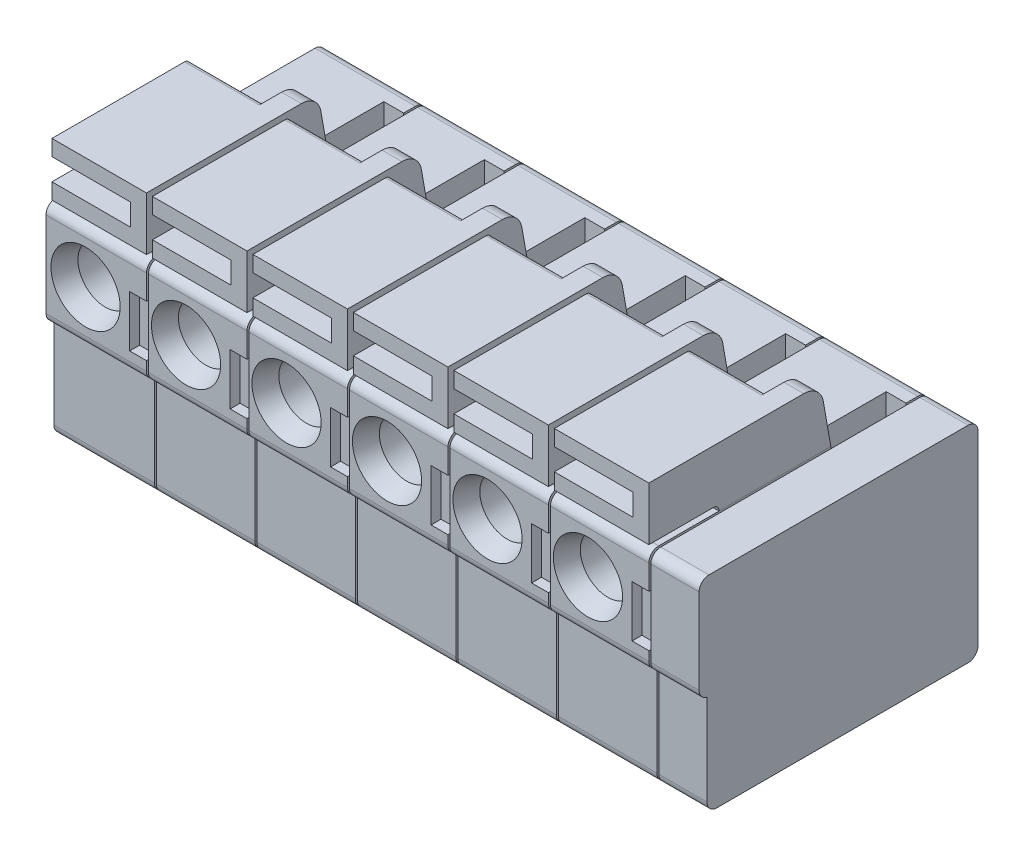
from build123d import *

# Parameters (mm, degrees)
EXTRUDE_1_DEPTH               = 33.02
FILLET_1_R                    = 0.5
SKETCH_2_W                    = 1
SKETCH_2_H                    = 2.5
EXTRUDE_2_DEPTH               = 33.02
EXTRUDE_3_DEPTH               = 33.02
SKETCH_4_W                    = 2.29
SKETCH_4_H                    = 3.5
SKETCH_4_W_2                  = 4.58
SKETCH_4_W_3                  = 4.83
SKETCH_4_W_4                  = 0.3
SKETCH_4_H_2                  = 3
SKETCH_4_W_5                  = 2.54
CUT_EXTRUDE_1_DEPTH           = 39.323496709
SKETCH_5_W                    = 0.85
SKETCH_5_H                    = 2.6
CUT_EXTRUDE_2_DEPTH           = 0.5
SKETCH_6_W                    = 3.98
SKETCH_6_H                    = 1.1
CUT_EXTRUDE_3_DEPTH           = 1.5
SKETCH_7_R                    = 1.75
CUT_EXTRUDE_4_DEPTH           = 1
CUT_EXTRUDE_4_DRAFT           = -20
CUT_EXTRUDE_4_PROFILE_2_DEPTH = 1
CUT_EXTRUDE_4_PROFILE_2_DRAFT = -20
CUT_EXTRUDE_4_PROFILE_3_DEPTH = 1
CUT_EXTRUDE_4_PROFILE_3_DRAFT = -20
CUT_EXTRUDE_4_PROFILE_4_DEPTH = 1
CUT_EXTRUDE_4_PROFILE_4_DRAFT = -20
CUT_EXTRUDE_4_PROFILE_5_DEPTH = 1
CUT_EXTRUDE_4_PROFILE_5_DRAFT = -20
CUT_EXTRUDE_4_PROFILE_6_DEPTH = 1
CUT_EXTRUDE_4_PROFILE_6_DRAFT = -20
SKETCH_8_R                    = 1.386029766
CUT_EXTRUDE_5_DEPTH           = 8
CUT_EXTRUDE_6_DEPTH           = 39.065317548
CUT_EXTRUDE_6_DEPTH_BACK      = 3.78
CUT_EXTRUDE_7_DEPTH           = 3.78
CUT_EXTRUDE_8_DEPTH           = 3.78
CUT_EXTRUDE_9_DEPTH           = 3.78
CUT_EXTRUDE_10_DEPTH          = 3.78
CUT_EXTRUDE_11_DEPTH          = 3.78
SKETCH_17_W                   = 1
SKETCH_17_H                   = 3.8
CUT_EXTRUDE_12_DEPTH          = 3.78
SKETCH_18_W                   = 0.1
SKETCH_18_H                   = 13.4
CUT_EXTRUDE_13_DEPTH          = 39.323496709


with BuildPart() as part:
    # Эскиз1 → Бобышка-Вытянуть1 (new body)
    with BuildSketch(Plane(origin=(0, 0, 0), x_dir=(0, 0, -1), z_dir=(1, 0, 0))):
        Polygon((0.4, 5.1), (0.4, 0), (14.1, 0), (14.1, 10.4), (0, 10.4), (0, 5.1), align=None)
    extrude(amount=EXTRUDE_1_DEPTH)

    # Скругление1
    # the kernel refuses this fillet: 0.5 mm, written as the material it takes off along each edge
    with BuildSketch(Plane(origin=(-1.25, 10.4, -14.1), x_dir=(0, -1, 0), z_dir=(1, 0, 0)), Plane(origin=(-1.25, 0, -14.1), x_dir=(0, 0, 1), z_dir=(1, 0, 0)), Plane(origin=(-1.25, 0, -0.4), x_dir=(0, 1, 0), z_dir=(1, 0, 0)), Plane(origin=(-1.25, 10.4, 0), x_dir=(0, 0, -1), z_dir=(1, 0, 0))) as fillet_1_piece_1:
        with BuildLine():
            CenterArc((FILLET_1_R, -FILLET_1_R), FILLET_1_R, 90, 90)
            Line((0, -FILLET_1_R), (-FILLET_1_R * 0.02, -FILLET_1_R))
            Line((-FILLET_1_R * 0.02, -FILLET_1_R), (-FILLET_1_R * 0.02, FILLET_1_R * 0.02))
            Line((-FILLET_1_R * 0.02, FILLET_1_R * 0.02), (FILLET_1_R, FILLET_1_R * 0.02))
            Line((FILLET_1_R, FILLET_1_R * 0.02), (FILLET_1_R, 0))
        make_face()
    extrude(amount=35.52, mode=Mode.SUBTRACT)
    with BuildSketch(Plane(origin=(-1.224744871, 5.1, 0), x_dir=(0, 1, 0), z_dir=(1, 0, 0))) as fillet_1_piece_2:
        with BuildLine():
            CenterArc((0.489897949, -0.5), FILLET_1_R, 90, 78.463040967)
            Line((0, -0.4), (-0.009797959, -0.398))
            ThreePointArc((-0.009797959, -0.398), (-0.01, -0.2), (-0.01, 0))
            Line((-0.01, 0), (0, 0.01))
            Line((0, 0.01), (0.489897949, 0.01))
            Line((0.489897949, 0.01), (0.489897949, 0))
        make_face()
    extrude(amount=35.469489743, mode=Mode.SUBTRACT)

    # Эскиз5 → Вырез-Вытянуть2 (cut)
    with BuildSketch(Plane.XY):
        with Locations((4.655, 7.36)):
            Rectangle(SKETCH_5_W, SKETCH_5_H)
        with Locations((9.735, 7.36)):
            Rectangle(SKETCH_5_W, SKETCH_5_H)
        with Locations((14.815, 7.36)):
            Rectangle(SKETCH_5_W, SKETCH_5_H)
        with Locations((19.895, 7.36)):
            Rectangle(SKETCH_5_W, SKETCH_5_H)
        with Locations((24.975, 7.36)):
            Rectangle(SKETCH_5_W, SKETCH_5_H)
        with Locations((30.055, 7.36)):
            Rectangle(SKETCH_5_W, SKETCH_5_H)
    extrude(amount=-CUT_EXTRUDE_2_DEPTH, mode=Mode.SUBTRACT)


with BuildPart() as body_2:
    # Эскиз2 → Бобышка-Вытянуть2 (new body)
    with BuildSketch(Plane(origin=(0, 0, 0), x_dir=(0, 0, -1), z_dir=(1, 0, 0))):
        with Locations((12.35, -1.25)):
            Rectangle(SKETCH_2_W, SKETCH_2_H)
        Polygon((12.85, -2.5), (11.85, -2.5), (12.117949192, -3.5), (12.582050808, -3.5), align=None)
        with Locations((4.73, -1.25)):
            Rectangle(SKETCH_2_W, SKETCH_2_H)
        Polygon((5.23, -2.5), (4.23, -2.5), (4.497949192, -3.5), (4.962050808, -3.5), align=None)
    extrude(amount=EXTRUDE_2_DEPTH)


with BuildPart() as body_3:
    # Эскиз3 → Бобышка-Вытянуть3 (new body)
    with BuildSketch(Plane(origin=(0, 0, 0), x_dir=(0, 0, -1), z_dir=(1, 0, 0))):
        with BuildLine():
            Line((3.55, 10.4), (3.55, 10.41))
            ThreePointArc((3.55, 10.41), (3.465060967, 10.615060967), (3.26, 10.7))
            Line((3.26, 10.7), (0, 10.7))
            Line((0, 10.7), (0, 13.4))
            Line((0, 13.4), (7.831919427, 13.4))
            ThreePointArc((7.831919427, 13.4), (8.474707036, 13.166044443), (8.81672718, 12.573648178))
            Line((8.81672718, 12.573648178), (9.2, 10.4))
            Line((9.2, 10.4), (3.55, 10.4))
        make_face()
    extrude(amount=EXTRUDE_3_DEPTH)


with BuildPart() as cut_extrude_1_tool:
    # Эскиз4 → Вырез-Вытянуть1 (new, through all)
    with BuildSketch(Plane.XY):
        with Locations((1.145, -1.75)):
            Rectangle(SKETCH_4_W, SKETCH_4_H)
        with Locations((5.08, -1.75)):
            Rectangle(SKETCH_4_W_2, SKETCH_4_H)
        with Locations((10.16, -1.75)):
            Rectangle(SKETCH_4_W_2, SKETCH_4_H)
        with Locations((15.24, -1.75)):
            Rectangle(SKETCH_4_W_2, SKETCH_4_H)
        with Locations((20.32, -1.75)):
            Rectangle(SKETCH_4_W_2, SKETCH_4_H)
        with Locations((25.4, -1.75)):
            Rectangle(SKETCH_4_W_2, SKETCH_4_H)
        with Locations((30.605, -1.75)):
            Rectangle(SKETCH_4_W_3, SKETCH_4_H)
        with Locations((0.15, 11.9)):
            Rectangle(SKETCH_4_W_4, SKETCH_4_H_2)
        with Locations((5.23, 11.9)):
            Rectangle(SKETCH_4_W_4, SKETCH_4_H_2)
        with Locations((10.31, 11.9)):
            Rectangle(SKETCH_4_W_4, SKETCH_4_H_2)
        with Locations((15.39, 11.9)):
            Rectangle(SKETCH_4_W_4, SKETCH_4_H_2)
        with Locations((20.47, 11.9)):
            Rectangle(SKETCH_4_W_4, SKETCH_4_H_2)
        with Locations((25.55, 11.9)):
            Rectangle(SKETCH_4_W_4, SKETCH_4_H_2)
        with Locations((31.75, 11.9)):
            Rectangle(SKETCH_4_W_5, SKETCH_4_H_2)
    extrude(amount=-CUT_EXTRUDE_1_DEPTH)


with BuildPart() as body_2_1:
    add(body_2.part)

    # Вырез-Вытянуть1: cut by cut_extrude_1_tool
    add(cut_extrude_1_tool.part, mode=Mode.SUBTRACT)


with BuildPart() as body_3_1:
    add(body_3.part)

    # Вырез-Вытянуть1: cut by cut_extrude_1_tool
    add(cut_extrude_1_tool.part, mode=Mode.SUBTRACT)

    # Эскиз6 → Вырез-Вытянуть3 (cut)
    with BuildSketch(Plane.XY):
        with Locations((2.29, 12.05)):
            Rectangle(SKETCH_6_W, SKETCH_6_H)
        with Locations((7.37, 12.05)):
            Rectangle(SKETCH_6_W, SKETCH_6_H)
        with Locations((12.45, 12.05)):
            Rectangle(SKETCH_6_W, SKETCH_6_H)
        with Locations((17.53, 12.05)):
            Rectangle(SKETCH_6_W, SKETCH_6_H)
        with Locations((22.61, 12.05)):
            Rectangle(SKETCH_6_W, SKETCH_6_H)
        with Locations((27.69, 12.05)):
            Rectangle(SKETCH_6_W, SKETCH_6_H)
    extrude(amount=-CUT_EXTRUDE_3_DEPTH, mode=Mode.SUBTRACT)

    # Эскиз9 → Вырез-Вытянуть6 (cut, two sides: drawn at the far end of the back side and taken through both)
    with BuildSketch(Plane.ZY.offset(-0.3).offset(-CUT_EXTRUDE_6_DEPTH_BACK)):
        with BuildLine():
            Line((-3.26, 10.7), (-2.043352076, 10.7))
            Line((-2.043352076, 10.7), (-6.811498201, 12.923423053))
            ThreePointArc((-6.811498201, 12.923423053), (-6.949917637, 13.204109903), (-6.705843636, 13.4))
            Line((-6.705843636, 13.4), (-7.831919427, 13.4))
            ThreePointArc((-7.831919427, 13.4), (-8.474707036, 13.166044443), (-8.81672718, 12.573648178))
            Line((-8.81672718, 12.573648178), (-9.2, 10.4))
            Line((-9.2, 10.4), (-3.55, 10.4))
            Line((-3.55, 10.4), (-3.55, 10.41))
            ThreePointArc((-3.55, 10.41), (-3.465060967, 10.615060967), (-3.26, 10.7))
        make_face()
    extrude(amount=CUT_EXTRUDE_6_DEPTH + CUT_EXTRUDE_6_DEPTH_BACK, mode=Mode.SUBTRACT)

    # Эскиз10 → Вырез-Вытянуть7 (cut)
    with BuildSketch(Plane.ZY.offset(-5.38)):
        with BuildLine():
            Line((-8.81672718, 12.573648178), (-9.2, 10.4))
            Line((-9.2, 10.4), (-3.55, 10.4))
            Line((-3.55, 10.4), (-3.55, 10.41))
            ThreePointArc((-3.55, 10.41), (-3.465060967, 10.615060967), (-3.26, 10.7))
            Line((-3.26, 10.7), (-2.043352076, 10.7))
            Line((-2.043352076, 10.7), (-6.811498201, 12.923423053))
            ThreePointArc((-6.811498201, 12.923423053), (-6.949917637, 13.204109903), (-6.705843636, 13.4))
            Line((-6.705843636, 13.4), (-7.831919427, 13.4))
            ThreePointArc((-7.831919427, 13.4), (-8.474707036, 13.166044443), (-8.81672718, 12.573648178))
        make_face()
    extrude(amount=-CUT_EXTRUDE_7_DEPTH, mode=Mode.SUBTRACT)

    # Эскиз13 → Вырез-Вытянуть8 (cut)
    with BuildSketch(Plane.ZY.offset(-10.46)):
        with BuildLine():
            Line((-8.81672718, 12.573648178), (-9.2, 10.4))
            Line((-9.2, 10.4), (-3.55, 10.4))
            Line((-3.55, 10.4), (-3.55, 10.41))
            ThreePointArc((-3.55, 10.41), (-3.465060967, 10.615060967), (-3.26, 10.7))
            Line((-3.26, 10.7), (-2.043352076, 10.7))
            Line((-2.043352076, 10.7), (-6.811498201, 12.923423053))
            ThreePointArc((-6.811498201, 12.923423053), (-6.949917637, 13.204109903), (-6.705843636, 13.4))
            Line((-6.705843636, 13.4), (-7.831919427, 13.4))
            ThreePointArc((-7.831919427, 13.4), (-8.474707036, 13.166044443), (-8.81672718, 12.573648178))
        make_face()
    extrude(amount=-CUT_EXTRUDE_8_DEPTH, mode=Mode.SUBTRACT)

    # Эскиз14 → Вырез-Вытянуть9 (cut)
    with BuildSketch(Plane.ZY.offset(-15.54)):
        with BuildLine():
            Line((-8.81672718, 12.573648178), (-9.2, 10.4))
            Line((-9.2, 10.4), (-3.55, 10.4))
            Line((-3.55, 10.4), (-3.55, 10.41))
            ThreePointArc((-3.55, 10.41), (-3.465060967, 10.615060967), (-3.26, 10.7))
            Line((-3.26, 10.7), (-2.043352076, 10.7))
            Line((-2.043352076, 10.7), (-6.811498201, 12.923423053))
            ThreePointArc((-6.811498201, 12.923423053), (-6.949917637, 13.204109903), (-6.705843636, 13.4))
            Line((-6.705843636, 13.4), (-7.831919427, 13.4))
            ThreePointArc((-7.831919427, 13.4), (-8.474707036, 13.166044443), (-8.81672718, 12.573648178))
        make_face()
    extrude(amount=-CUT_EXTRUDE_9_DEPTH, mode=Mode.SUBTRACT)

    # Эскиз15 → Вырез-Вытянуть10 (cut)
    with BuildSketch(Plane.ZY.offset(-20.62)):
        with BuildLine():
            Line((-8.81672718, 12.573648178), (-9.2, 10.4))
            Line((-9.2, 10.4), (-3.55, 10.4))
            Line((-3.55, 10.4), (-3.55, 10.41))
            ThreePointArc((-3.55, 10.41), (-3.465060967, 10.615060967), (-3.26, 10.7))
            Line((-3.26, 10.7), (-2.043352076, 10.7))
            Line((-2.043352076, 10.7), (-6.811498201, 12.923423053))
            ThreePointArc((-6.811498201, 12.923423053), (-6.949917637, 13.204109903), (-6.705843636, 13.4))
            Line((-6.705843636, 13.4), (-7.831919427, 13.4))
            ThreePointArc((-7.831919427, 13.4), (-8.474707036, 13.166044443), (-8.81672718, 12.573648178))
        make_face()
    extrude(amount=-CUT_EXTRUDE_10_DEPTH, mode=Mode.SUBTRACT)

    # Эскиз16 → Вырез-Вытянуть11 (cut)
    with BuildSketch(Plane.ZY.offset(-25.7)):
        with BuildLine():
            Line((-8.81672718, 12.573648178), (-9.2, 10.4))
            Line((-9.2, 10.4), (-3.55, 10.4))
            Line((-3.55, 10.4), (-3.55, 10.41))
            ThreePointArc((-3.55, 10.41), (-3.465060967, 10.615060967), (-3.26, 10.7))
            Line((-3.26, 10.7), (-2.043352076, 10.7))
            Line((-2.043352076, 10.7), (-6.811498201, 12.923423053))
            ThreePointArc((-6.811498201, 12.923423053), (-6.949917637, 13.204109903), (-6.705843636, 13.4))
            Line((-6.705843636, 13.4), (-7.831919427, 13.4))
            ThreePointArc((-7.831919427, 13.4), (-8.474707036, 13.166044443), (-8.81672718, 12.573648178))
        make_face()
    extrude(amount=-CUT_EXTRUDE_11_DEPTH, mode=Mode.SUBTRACT)


with BuildPart() as cut_extrude_4_tool:
    # Эскиз7 → Вырез-Вытянуть4 (with draft: the straight prism first)
    with BuildSketch(Plane.XY):
        with Locations((2, 7.744948974)):
            Circle(SKETCH_7_R)
    extrude(amount=-CUT_EXTRUDE_4_DEPTH)
    # Вырез-Вытянуть4: the draft: its side faces are tilted about the plane it starts from
    cut_extrude_4_sides = [cut_extrude_4_tool.faces().sort_by_distance(p)[0] for p in [
        (0.25, 7.744948974, -0.5),
    ]]
    draft(cut_extrude_4_sides, Plane.XY, CUT_EXTRUDE_4_DRAFT)


with BuildPart() as part_1:
    add(part.part)

    # Вырез-Вытянуть4: cut by cut_extrude_4_tool
    add(cut_extrude_4_tool.part, mode=Mode.SUBTRACT)


with BuildPart() as cut_extrude_4_profile_2_tool:
    # Эскиз7 → Вырез-Вытянуть4 profile 2 (with draft: the straight prism first)
    with BuildSketch(Plane.XY):
        with Locations((7.08, 7.744948974)):
            Circle(SKETCH_7_R)
    extrude(amount=-CUT_EXTRUDE_4_PROFILE_2_DEPTH)
    # Вырез-Вытянуть4 profile 2: the draft: its side faces are tilted about the plane it starts from
    cut_extrude_4_profile_2_sides = [cut_extrude_4_profile_2_tool.faces().sort_by_distance(p)[0] for p in [
        (5.33, 7.744948974, -0.5),
    ]]
    draft(cut_extrude_4_profile_2_sides, Plane.XY, CUT_EXTRUDE_4_PROFILE_2_DRAFT)


with BuildPart() as part_2:
    add(part_1.part)

    # Вырез-Вытянуть4 profile 2: cut by cut_extrude_4_profile_2_tool
    add(cut_extrude_4_profile_2_tool.part, mode=Mode.SUBTRACT)


with BuildPart() as cut_extrude_4_profile_3_tool:
    # Эскиз7 → Вырез-Вытянуть4 profile 3 (with draft: the straight prism first)
    with BuildSketch(Plane.XY):
        with Locations((12.16, 7.744948974)):
            Circle(SKETCH_7_R)
    extrude(amount=-CUT_EXTRUDE_4_PROFILE_3_DEPTH)
    # Вырез-Вытянуть4 profile 3: the draft: its side faces are tilted about the plane it starts from
    cut_extrude_4_profile_3_sides = [cut_extrude_4_profile_3_tool.faces().sort_by_distance(p)[0] for p in [
        (10.41, 7.744948974, -0.5),
    ]]
    draft(cut_extrude_4_profile_3_sides, Plane.XY, CUT_EXTRUDE_4_PROFILE_3_DRAFT)


with BuildPart() as part_3:
    add(part_2.part)

    # Вырез-Вытянуть4 profile 3: cut by cut_extrude_4_profile_3_tool
    add(cut_extrude_4_profile_3_tool.part, mode=Mode.SUBTRACT)


with BuildPart() as cut_extrude_4_profile_4_tool:
    # Эскиз7 → Вырез-Вытянуть4 profile 4 (with draft: the straight prism first)
    with BuildSketch(Plane.XY):
        with Locations((17.24, 7.744948974)):
            Circle(SKETCH_7_R)
    extrude(amount=-CUT_EXTRUDE_4_PROFILE_4_DEPTH)
    # Вырез-Вытянуть4 profile 4: the draft: its side faces are tilted about the plane it starts from
    cut_extrude_4_profile_4_sides = [cut_extrude_4_profile_4_tool.faces().sort_by_distance(p)[0] for p in [
        (15.49, 7.744948974, -0.5),
    ]]
    draft(cut_extrude_4_profile_4_sides, Plane.XY, CUT_EXTRUDE_4_PROFILE_4_DRAFT)


with BuildPart() as part_4:
    add(part_3.part)

    # Вырез-Вытянуть4 profile 4: cut by cut_extrude_4_profile_4_tool
    add(cut_extrude_4_profile_4_tool.part, mode=Mode.SUBTRACT)


with BuildPart() as cut_extrude_4_profile_5_tool:
    # Эскиз7 → Вырез-Вытянуть4 profile 5 (with draft: the straight prism first)
    with BuildSketch(Plane.XY):
        with Locations((22.32, 7.744948974)):
            Circle(SKETCH_7_R)
    extrude(amount=-CUT_EXTRUDE_4_PROFILE_5_DEPTH)
    # Вырез-Вытянуть4 profile 5: the draft: its side faces are tilted about the plane it starts from
    cut_extrude_4_profile_5_sides = [cut_extrude_4_profile_5_tool.faces().sort_by_distance(p)[0] for p in [
        (20.57, 7.744948974, -0.5),
    ]]
    draft(cut_extrude_4_profile_5_sides, Plane.XY, CUT_EXTRUDE_4_PROFILE_5_DRAFT)


with BuildPart() as part_5:
    add(part_4.part)

    # Вырез-Вытянуть4 profile 5: cut by cut_extrude_4_profile_5_tool
    add(cut_extrude_4_profile_5_tool.part, mode=Mode.SUBTRACT)


with BuildPart() as cut_extrude_4_profile_6_tool:
    # Эскиз7 → Вырез-Вытянуть4 profile 6 (with draft: the straight prism first)
    with BuildSketch(Plane.XY):
        with Locations((27.4, 7.744948974)):
            Circle(SKETCH_7_R)
    extrude(amount=-CUT_EXTRUDE_4_PROFILE_6_DEPTH)
    # Вырез-Вытянуть4 profile 6: the draft: its side faces are tilted about the plane it starts from
    cut_extrude_4_profile_6_sides = [cut_extrude_4_profile_6_tool.faces().sort_by_distance(p)[0] for p in [
        (25.65, 7.744948974, -0.5),
    ]]
    draft(cut_extrude_4_profile_6_sides, Plane.XY, CUT_EXTRUDE_4_PROFILE_6_DRAFT)


with BuildPart() as part_6:
    add(part_5.part)

    # Вырез-Вытянуть4 profile 6: cut by cut_extrude_4_profile_6_tool
    add(cut_extrude_4_profile_6_tool.part, mode=Mode.SUBTRACT)

    # Эскиз8 → Вырез-Вытянуть5 (cut)
    with BuildSketch(Plane.XY.offset(-1)):
        with Locations((27.4, 7.744948974)):
            Circle(SKETCH_8_R)
        with Locations((22.32, 7.744948974)):
            Circle(SKETCH_8_R)
        with Locations((17.24, 7.744948974)):
            Circle(SKETCH_8_R)
        with Locations((12.16, 7.744948974)):
            Circle(SKETCH_8_R)
        with Locations((7.08, 7.744948974)):
            Circle(SKETCH_8_R)
        with Locations((2, 7.744948974)):
            Circle(SKETCH_8_R)
    extrude(amount=-CUT_EXTRUDE_5_DEPTH, mode=Mode.SUBTRACT)

    # Эскиз17 → Вырез-Вытянуть12 (cut)
    with BuildSketch(Plane(origin=(0, 10.4, 0), x_dir=(1, 0, 0), z_dir=(0, 1, 0))):
        with Locations((4.58, 11.1)):
            Rectangle(SKETCH_17_W, SKETCH_17_H)
        with Locations((9.66, 11.1)):
            Rectangle(SKETCH_17_W, SKETCH_17_H)
        with Locations((14.74, 11.1)):
            Rectangle(SKETCH_17_W, SKETCH_17_H)
        with Locations((19.82, 11.1)):
            Rectangle(SKETCH_17_W, SKETCH_17_H)
        with Locations((24.9, 11.1)):
            Rectangle(SKETCH_17_W, SKETCH_17_H)
        with Locations((29.98, 11.1)):
            Rectangle(SKETCH_17_W, SKETCH_17_H)
    extrude(amount=-CUT_EXTRUDE_12_DEPTH, mode=Mode.SUBTRACT)

    # Эскиз18 → Вырез-Вытянуть13 (cut, through all)
    with BuildSketch(Plane.XY):
        with Locations((5.13, 6.7)):
            Rectangle(SKETCH_18_W, SKETCH_18_H)
        with Locations((10.21, 6.7)):
            Rectangle(SKETCH_18_W, SKETCH_18_H)
        with Locations((15.29, 6.7)):
            Rectangle(SKETCH_18_W, SKETCH_18_H)
        with Locations((20.37, 6.7)):
            Rectangle(SKETCH_18_W, SKETCH_18_H)
        with Locations((25.45, 6.7)):
            Rectangle(SKETCH_18_W, SKETCH_18_H)
        with Locations((30.53, 6.7)):
            Rectangle(SKETCH_18_W, SKETCH_18_H)
    extrude(amount=-CUT_EXTRUDE_13_DEPTH, mode=Mode.SUBTRACT)


with BuildPart() as cut_extrude_13_piece_1:
    # of the separate pieces the step leaves, piece 1, a body of its own (cut_extrude_13_pieces)
    add(part_6.part.solids().sort_by_distance((0, 5.1, -0.4))[0])


with BuildPart() as cut_extrude_13_piece_2:
    # of the separate pieces the step leaves, piece 2, a body of its own (cut_extrude_13_pieces)
    add(part_6.part.solids().sort_by_distance((20.42, 0.5, -0.4))[0])


with BuildPart() as cut_extrude_13_piece_3:
    # of the separate pieces the step leaves, piece 3, a body of its own (cut_extrude_13_pieces)
    add(part_6.part.solids().sort_by_distance((25.5, 0.5, -0.4))[0])


with BuildPart() as cut_extrude_13_piece_4:
    # of the separate pieces the step leaves, piece 4, a body of its own (cut_extrude_13_pieces)
    add(part_6.part.solids().sort_by_distance((5.18, 0.5, -0.4))[0])


with BuildPart() as cut_extrude_13_piece_5:
    # of the separate pieces the step leaves, piece 5, a body of its own (cut_extrude_13_pieces)
    add(part_6.part.solids().sort_by_distance((10.26, 0.5, -0.4))[0])


with BuildPart() as cut_extrude_13_piece_6:
    # of the separate pieces the step leaves, piece 6, a body of its own (cut_extrude_13_pieces)
    add(part_6.part.solids().sort_by_distance((15.34, 0.5, -0.4))[0])


with BuildPart() as cut_extrude_13_piece_7:
    # of the separate pieces the step leaves, piece 7, a body of its own (cut_extrude_13_pieces)
    add(part_6.part.solids().sort_by_distance((30.58, 0.5, -0.4))[0])


solid = Compound([body_2_1.part, body_3_1.part, cut_extrude_13_piece_1.part, cut_extrude_13_piece_2.part, cut_extrude_13_piece_3.part, cut_extrude_13_piece_4.part, cut_extrude_13_piece_5.part, cut_extrude_13_piece_6.part, cut_extrude_13_piece_7.part])
